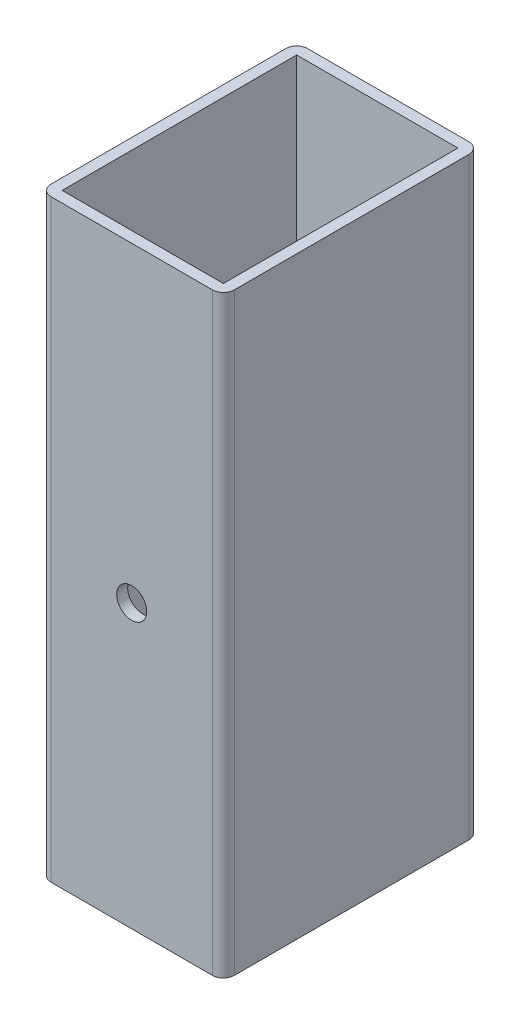
from build123d import *

# Parameters (mm, degrees)
SKETCH_1_W         = 50
SKETCH_1_H         = 162
BLOCKEXTRUDE_DEPTH = 70
FILLET_2_R         = 3
SHELL_START        = 3
SHELL_1_OUTLINE_W  = 159
SHELL_1_OUTLINE_H  = 64
SHELL_1_DEPTH      = 44
SKETCH_2_R         = 4.1
CABLE_ENTRY_DEPTH  = 184.423008371


# Read off the part's stored shape, not the designer's step: 抽壳1
with BuildPart() as part:
    # 草图1 → BlockExtrude (new body)
    with BuildSketch(Plane.XY):
        with Locations((25, 81)):
            Rectangle(SKETCH_1_W, SKETCH_1_H)
    extrude(amount=BLOCKEXTRUDE_DEPTH)

    # Fillet 2
    fillet_2_edges = [part.edges().sort_by_distance(p)[0] for p in [
        (50, 81, 70),
        (0, 81, 70),
        (50, 81, 0),
        (0, 81, 0),
    ]]
    fillet(fillet_2_edges, radius=FILLET_2_R)

    # 抽壳1 outline → 抽壳1 (cut)
    with BuildSketch(Plane.YZ.offset(SHELL_START)):
        with Locations((82.5, 35)):
            Rectangle(SHELL_1_OUTLINE_W, SHELL_1_OUTLINE_H)
    extrude(amount=SHELL_1_DEPTH, mode=Mode.SUBTRACT)

    # 草图2 → Cable_entry (cut, through all)
    with BuildSketch(Plane(origin=(0, 0, 0), x_dir=(-1, 0, 0), z_dir=(0, 0, -1))):
        with Locations((-25, 77)):
            Circle(SKETCH_2_R)
    extrude(amount=-CABLE_ENTRY_DEPTH, mode=Mode.SUBTRACT)


solid = part.part
